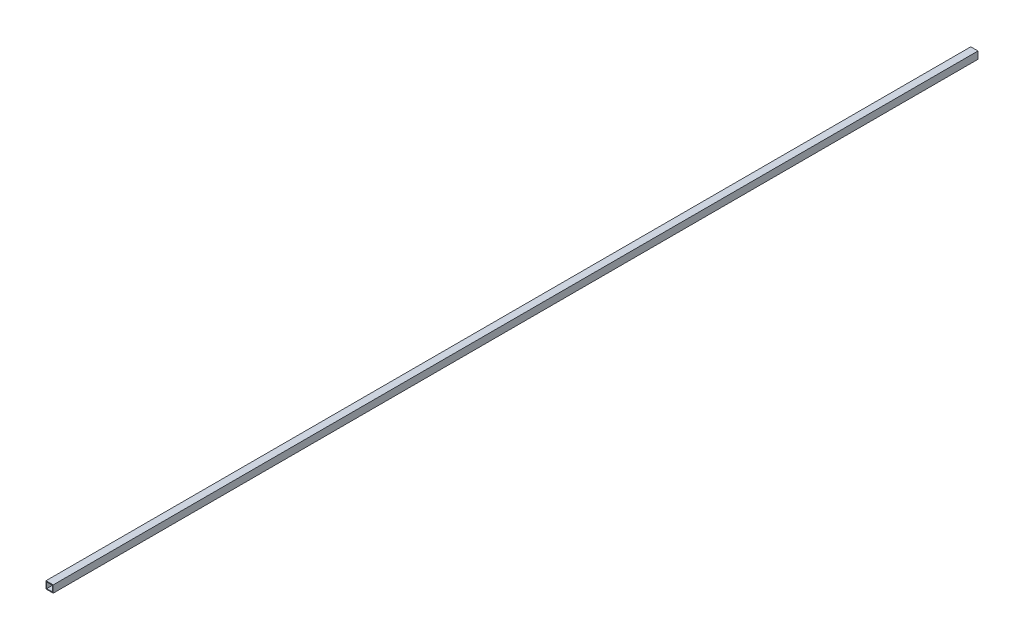
from build123d import *

# Parameters (mm, degrees)
SKETCH1_W           = 19.05
SKETCH1_H           = 19.05
BOSS_EXTRUDE1_DEPTH = 2438.4
SKETCH2_W           = 15.24
SKETCH2_H           = 15.24
CUT_EXTRUDE1_DEPTH  = 2439.548823583


with BuildPart() as part:
    # Sketch1 → Boss-Extrude1 (new body)
    with BuildSketch(Plane.XY):
        with Locations((9.525, 9.525)):
            Rectangle(SKETCH1_W, SKETCH1_H)
    extrude(amount=-BOSS_EXTRUDE1_DEPTH)

    # Sketch2 → Cut-Extrude1 (cut, through all)
    with BuildSketch(Plane.XY):
        with Locations((9.525, 9.525)):
            Rectangle(SKETCH2_W, SKETCH2_H)
    extrude(amount=-CUT_EXTRUDE1_DEPTH, mode=Mode.SUBTRACT)


solid = part.part
